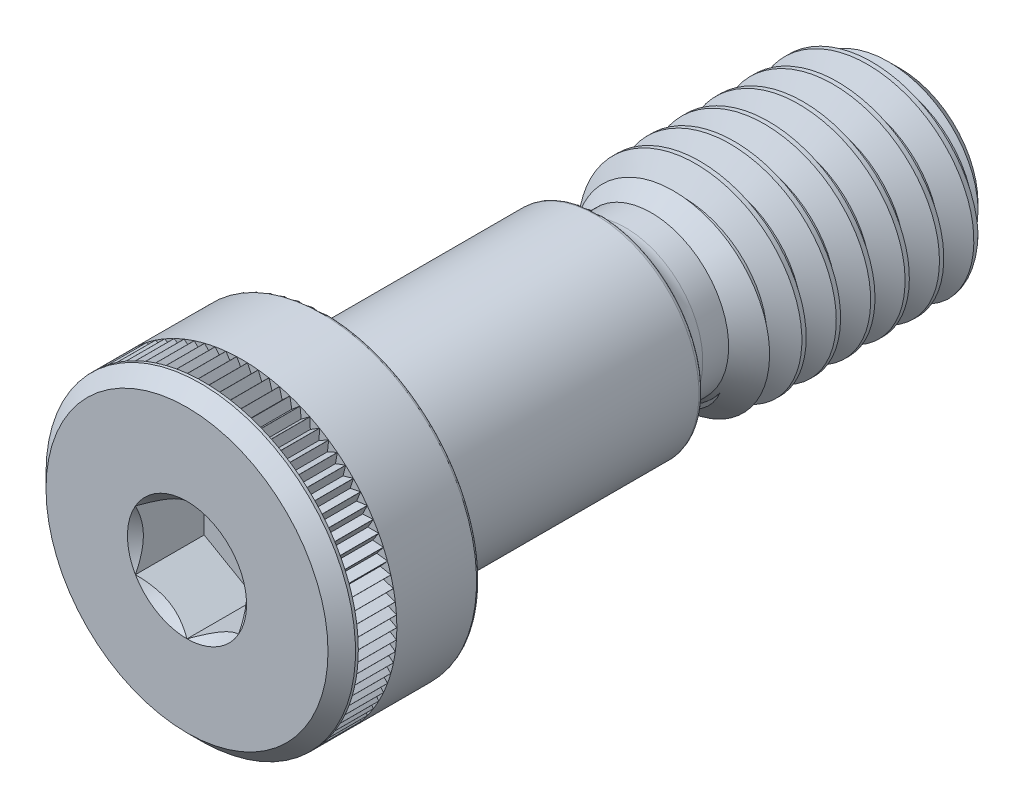
from build123d import *

# Parameters (mm, degrees)
CUT_EXTRUDE2_DEPTH = 3.175
CUT_SWEEP1_PITCH   = 1.5875
CUT_EXTRUDE5_DEPTH = 1.778
CIRPATTERN1_COUNT  = 90


with BuildPart() as part:
    # Sketch12 → Revolve1 (revolve)
    with BuildSketch(Plane(origin=(0, 0, 0), x_dir=(0, 0, -1), z_dir=(1, 0, 0)), mode=Mode.PRIVATE) as revolve1_sk:
        with BuildLine():
            Line((-16.4703125, 0), (-16.4703125, 6.50875))
            Line((-16.4703125, 6.50875), (-15.8353125, 7.14375))
            Line((-15.8353125, 7.14375), (-10.2473125, 7.14375))
            ThreePointArc((-10.2473125, 7.14375), (-10.157509939, 7.106552561), (-10.1203125, 7.01675))
            Line((-10.1203125, 7.01675), (-10.1203125, 4.429125))
            Line((-10.1203125, 4.429125), (-8.8503125, 4.429125))
            Line((-8.8503125, 4.429125), (-8.8503125, 4.572))
            ThreePointArc((-8.8503125, 4.572), (-8.794516342, 4.706703842), (-8.6598125, 4.7625))
            Line((-8.6598125, 4.7625), (2.40238852, 4.7625))
            ThreePointArc((2.40238852, 4.7625), (2.527457897, 4.715693775), (2.591067689, 4.598275862))
            ThreePointArc((2.591067689, 4.598275862), (2.988628892, 3.864413909), (3.7703125, 3.571875))
            Line((3.7703125, 3.571875), (4.9609375, 3.571875))
            Line((4.9609375, 3.571875), (6.1515625, 4.7625))
            Line((6.1515625, 4.7625), (15.2796875, 4.7625))
            Line((15.2796875, 4.7625), (16.4703125, 3.571875))
            Line((16.4703125, 3.571875), (16.4703125, 0))
            Line((16.4703125, 0), (-16.4703125, 0))
        make_face()
    revolve(revolve1_sk.sketch.rotate(Axis((0, 0, -16.4703125), (0, 0, 1)), 90), axis=Axis((0, 0, -16.4703125), (0, 0, 1)))

    # Sketch8 → Cut-Extrude2 (cut)
    with BuildSketch(Plane.XY.offset(16.4703125)):
        Polygon((0, -2.749630657), (2.38125, -1.374815329), (2.38125, 1.374815329), (0, 2.749630657), (-2.38125, 1.374815329), (-2.38125, -1.374815329), align=None)
    extrude(amount=-CUT_EXTRUDE2_DEPTH, mode=Mode.SUBTRACT)

    # Cut-Extrude4 cone 1 section (through the dimple's axis) → Cut-Extrude4 (revolve, cut)
    with BuildSketch(Plane(origin=(0, 0, 16.4703125), x_dir=(0, -1, 0), z_dir=(1, 0, 0))):
        Polygon((0, 0), (2.749630657, 0), (0, 2.749630657), align=None)
    revolve(axis=Axis((0, 0, 16.4703125), (0, 0, -1)), mode=Mode.SUBTRACT)


with BuildPart() as body_2:
    # Split1: the piece on the far side of the plane
    add(part.part)
    split(bisect_by=Plane(origin=(0, 0, -4.9609375), x_dir=(0, -1, 0), z_dir=(0, 0, -1)), keep=Keep.BOTTOM)


with BuildPart() as part_1:
    add(part.part)

    # Split1
    split(bisect_by=Plane(origin=(0, 0, -4.9609375), x_dir=(0, -1, 0), z_dir=(0, 0, -1)), keep=Keep.TOP)

    # Cut-Sweep1: the profile of Sketch13 screwed along a right-hand helix of 8 turns, 8 arcs to a turn; built about Z, then put on its axis
    cut_sweep1_z = Axis((0, 0, 0), (0, 0, 1))
    cut_sweep1_corners = [(4.848425958, 0, 0.049609375), (4.848425958, 0, -1.438671875), (3.731388504, 0, -0.79375), (3.731388504, 0, -0.5953125)]
    with BuildLine(mode=Mode.PRIVATE) as cut_sweep1_profile:
        Line(cut_sweep1_corners[0], cut_sweep1_corners[1])
        Line(cut_sweep1_corners[1], cut_sweep1_corners[2])
        Line(cut_sweep1_corners[2], cut_sweep1_corners[3])
        Line(cut_sweep1_corners[3], cut_sweep1_corners[0])
    cut_sweep1_cap = Face(cut_sweep1_profile.wire())
    cut_sweep1_turn_angles = [0, 22.5, 45, 67.5, 90, 112.5, 135, 157.5, 180, 202.5, 225, 247.5, 270, 292.5, 315, 337.5, 360]
    cut_sweep1_turn_weights = [1, 0.9238795325112867, 1, 0.9238795325112867, 1, 0.9238795325112867, 1, 0.9238795325112867, 1, 0.9238795325112867, 1, 0.9238795325112867, 1, 0.9238795325112867, 1, 0.9238795325112867, 1]
    cut_sweep1_turn_rails = [Edge.make_bspline([Vector(p[0], p[1], 0).rotate(cut_sweep1_z, cut_sweep1_turn_angles[k]) / cut_sweep1_turn_weights[k] + Vector(0, 0, p[2] + CUT_SWEEP1_PITCH * cut_sweep1_turn_angles[k] / 360) for k in range(17)], [0, 0, 0, 1, 1, 2, 2, 3, 3, 4, 4, 5, 5, 6, 6, 7, 7, 8, 8, 8], 2, cut_sweep1_turn_weights) for p in cut_sweep1_corners]
    cut_sweep1_turn_sides = [Face.make_surface_from_curves(cut_sweep1_turn_rails[p[0]], cut_sweep1_turn_rails[p[1]]) for p in [(0, 1), (1, 2), (2, 3), (3, 0)]]
    cut_sweep1 = Plane(origin=(0, 0, -16.4703125), x_dir=(0, 1, 0), z_dir=(0, 0, 1)) * Solid(Shell([*[p.moved(Location((0, 0, CUT_SWEEP1_PITCH * i))) for i in range(8) for p in cut_sweep1_turn_sides], cut_sweep1_cap, cut_sweep1_cap.rotate(cut_sweep1_z, 2880).moved(Location((0, 0, CUT_SWEEP1_PITCH * 2880 / 360)))]))
    add(cut_sweep1, mode=Mode.SUBTRACT)


with BuildPart() as body_2_1:
    add(body_2.part)

    # Combine1: union part
    add(part_1.part)

    # Sketch11 → Cut-Extrude5 (cut)
    with BuildSketch(Plane.XY.offset(15.7083125)):
        Polygon((0.249465247, 7.14375), (0, 6.711663517), (-0.249465247, 7.14375), align=None)
    cut_extrude5 = extrude(amount=-CUT_EXTRUDE5_DEPTH, mode=Mode.SUBTRACT)

    # CirPattern1: Cut-Extrude5 ×90 about axis
    cirpattern1_axis = Axis((0, 0, 0), (0, 0, 1))
    for i in range(1, CIRPATTERN1_COUNT):
        add(cut_extrude5.rotate(cirpattern1_axis, i * 360 / CIRPATTERN1_COUNT), mode=Mode.SUBTRACT)


solid = body_2_1.part
